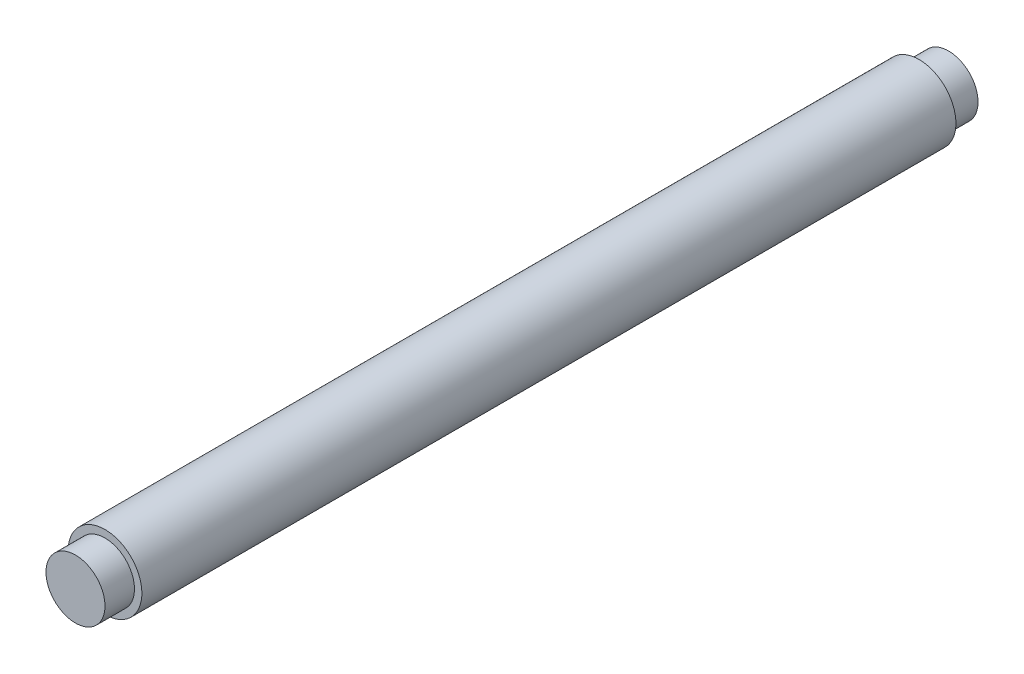
from build123d import *

# Parameters (mm, degrees)
SKETCH2_R           = 7.9375
BOSS_EXTRUDE1_DEPTH = 187.96
SKETCH11_W          = 1.5875
SKETCH11_H          = 6.35


with BuildPart() as part:
    # Sketch2 → Boss-Extrude1 (new body)
    with BuildSketch(Plane.XY):
        Circle(SKETCH2_R)
    extrude(amount=BOSS_EXTRUDE1_DEPTH)

    # Sketch11 → Cut-Revolve1 (revolve, cut)
    with BuildSketch(Plane(origin=(0, 0, 0), x_dir=(1, 0, 0), z_dir=(0, 1, 0))):
        with Locations((7.14375, -3.175)):
            Rectangle(SKETCH11_W, SKETCH11_H)
        with Locations((7.14375, -184.785)):
            Rectangle(SKETCH11_W, SKETCH11_H)
    revolve(axis=Axis((0, 0, 0), (0, 0, 1)), mode=Mode.SUBTRACT)


solid = part.part
